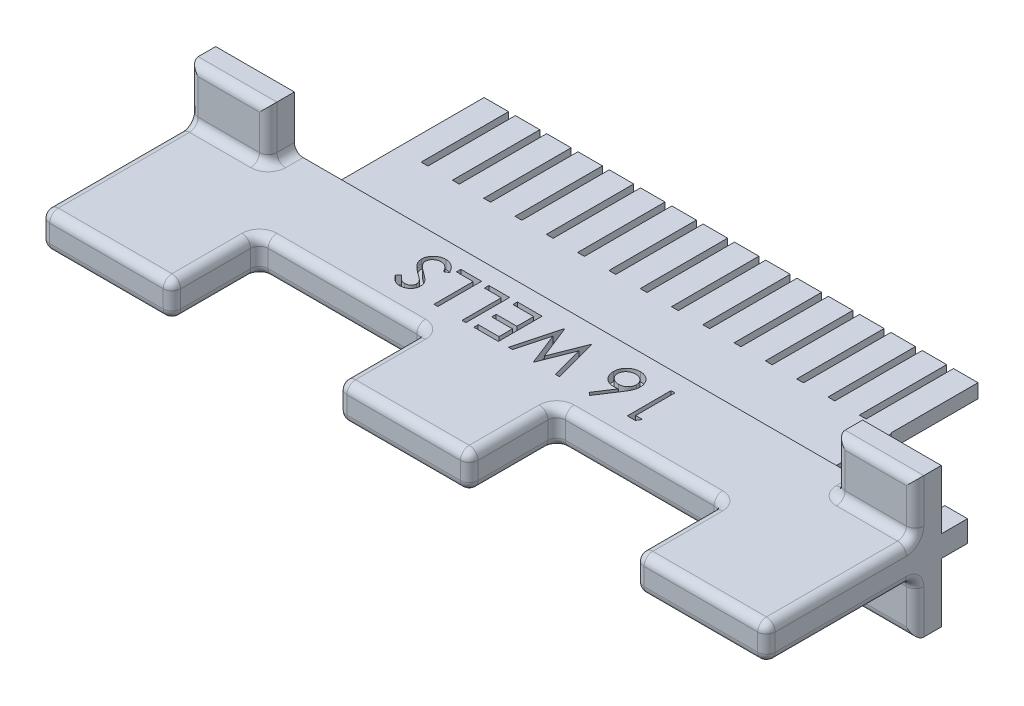
from build123d import *

# Parameters (mm, degrees)
SKETCH1_W           = 83
SKETCH1_H           = 4
BOSS_EXTRUDE1_DEPTH = 10
SKETCH2_W           = 15
SKETCH2_H           = 4
BOSS_EXTRUDE2_DEPTH = 10
SKETCH3_W           = 2.6
SKETCH3_H           = 2.45
BOSS_EXTRUDE3_DEPTH = 3
SKETCH4_W           = 56.6
SKETCH4_H           = 1.6
BOSS_EXTRUDE4_DEPTH = 7.5
SKETCH5_W           = 2.8
SKETCH5_H           = 1.6
BOSS_EXTRUDE5_DEPTH = 10
SKETCH6_W           = 9
SKETCH6_H           = 6
BOSS_EXTRUDE6_DEPTH = 3
FILLET1_R           = 1
CUT_EXTRUDE1_DEPTH  = 1


with BuildPart() as part:
    # Sketch1 → Boss-Extrude1 (new body)
    with BuildSketch(Plane.XY):
        Rectangle(SKETCH1_W, SKETCH1_H)
    extrude(amount=BOSS_EXTRUDE1_DEPTH)

    # Sketch2 → Boss-Extrude2 (add)
    with BuildSketch(Plane.XY.offset(10)):
        with Locations((-34, 0)):
            Rectangle(SKETCH2_W, SKETCH2_H)
        with Locations((34, 0)):
            Rectangle(SKETCH2_W, SKETCH2_H)
        Rectangle(SKETCH2_W, SKETCH2_H)
    extrude(amount=BOSS_EXTRUDE2_DEPTH)

    # Sketch3 → Boss-Extrude3 (add)
    with BuildSketch(Plane(origin=(0, 0, 0), x_dir=(-1, 0, 0), z_dir=(0, 0, -1))):
        with Locations((40.2, 0)):
            Rectangle(SKETCH3_W, SKETCH3_H)
        with Locations((-40.2, 0)):
            Rectangle(SKETCH3_W, SKETCH3_H)
    extrude(amount=BOSS_EXTRUDE3_DEPTH)

    # Sketch4 → Boss-Extrude4 (add)
    with BuildSketch(Plane(origin=(0, 0, 0), x_dir=(-1, 0, 0), z_dir=(0, 0, -1))):
        Rectangle(SKETCH4_W, SKETCH4_H)
    extrude(amount=BOSS_EXTRUDE4_DEPTH)

    # Sketch5 → Boss-Extrude5 (add)
    with BuildSketch(Plane(origin=(0, 0, -7.5), x_dir=(-1, 0, 0), z_dir=(0, 0, -1))):
        with Locations((26.9, 0)):
            Rectangle(SKETCH5_W, SKETCH5_H)
        with Locations((23.320008369, 0)):
            Rectangle(SKETCH5_W, SKETCH5_H)
        with Locations((19.740016738, 0)):
            Rectangle(SKETCH5_W, SKETCH5_H)
        with Locations((16.160025108, 0)):
            Rectangle(SKETCH5_W, SKETCH5_H)
        with Locations((12.580033477, 0)):
            Rectangle(SKETCH5_W, SKETCH5_H)
        with Locations((9.000041846, 0)):
            Rectangle(SKETCH5_W, SKETCH5_H)
        with Locations((5.420050215, 0)):
            Rectangle(SKETCH5_W, SKETCH5_H)
        with Locations((1.840058584, 0)):
            Rectangle(SKETCH5_W, SKETCH5_H)
        with Locations((-1.739933046, 0)):
            Rectangle(SKETCH5_W, SKETCH5_H)
        with Locations((-5.319924677, 0)):
            Rectangle(SKETCH5_W, SKETCH5_H)
        with Locations((-8.899916308, 0)):
            Rectangle(SKETCH5_W, SKETCH5_H)
        with Locations((-12.479907939, 0)):
            Rectangle(SKETCH5_W, SKETCH5_H)
        with Locations((-16.05989957, 0)):
            Rectangle(SKETCH5_W, SKETCH5_H)
        with Locations((-19.6398912, 0)):
            Rectangle(SKETCH5_W, SKETCH5_H)
        with Locations((-23.219882831, 0)):
            Rectangle(SKETCH5_W, SKETCH5_H)
        with Locations((-26.799874462, 0)):
            Rectangle(SKETCH5_W, SKETCH5_H)
    extrude(amount=BOSS_EXTRUDE5_DEPTH)

    # Sketch6 → Boss-Extrude6 (add)
    with BuildSketch(Plane(origin=(0, 0, 0), x_dir=(-1, 0, 0), z_dir=(0, 0, -1))):
        with Locations((37, -5)):
            Rectangle(SKETCH6_W, SKETCH6_H)
        with Locations((37, 5)):
            Rectangle(SKETCH6_W, SKETCH6_H)
        with Locations((-37, -5)):
            Rectangle(SKETCH6_W, SKETCH6_H)
        with Locations((-37, 5)):
            Rectangle(SKETCH6_W, SKETCH6_H)
    extrude(amount=-BOSS_EXTRUDE6_DEPTH)

    # Fillet1
    fillet1_edges = [part.edges().sort_by_distance(p)[0] for p in [
        (-41.5, -2, 11.5),
        (-32.5, -2, 1.5),
        (-37, -2, 3),
        (-32.5, -5, 3),
        (-37, -8, 3),
        (-41.5, -5, 3),
        (-26.5, 0, 20),
        (-34, -2, 20),
        (-41.5, 0, 20),
        (-34, 2, 20),
        (32.5, -2, 1.5),
        (41.5, -2, 11.5),
        (41.5, 2, 11.5),
        (32.5, 2, 1.5),
        (-32.5, 2, 1.5),
        (-41.5, 2, 11.5),
        (37, -8, 3),
        (32.5, -5, 3),
        (37, -2, 3),
        (41.5, -5, 3),
        (34, -2, 20),
        (26.5, 0, 20),
        (34, 2, 20),
        (41.5, 0, 20),
        (37, 2, 3),
        (32.5, 5, 3),
        (37, 8, 3),
        (41.5, 5, 3),
        (0, -2, 20),
        (-7.5, 0, 20),
        (0, 2, 20),
        (7.5, 0, 20),
        (-37, 8, 3),
        (-32.5, 5, 3),
        (-37, 2, 3),
        (-41.5, 5, 3),
        (26.5, 2, 15),
        (26.5, -2, 15),
        (26.5, 0, 10),
        (17, -2, 10),
        (17, 2, 10),
        (7.5, -2, 15),
        (7.5, 2, 15),
        (7.5, 0, 10),
        (-7.5, 2, 15),
        (-7.5, -2, 15),
        (-26.5, -2, 15),
        (-26.5, 2, 15),
        (-26.5, 0, 10),
        (-17, 2, 10),
        (-7.5, 0, 10),
        (-17, -2, 10),
    ]]
    fillet(fillet1_edges, radius=FILLET1_R)

    # Sketch8 → Cut-Extrude1 (cut)
    # profile 1 of 7: a face of its own
    with BuildSketch(Plane(origin=(0, 2, 0), x_dir=(1, 0, 0), z_dir=(0, 1, 0))):
        Polygon((13.552684295, -7.045024133), (12.628205128, -7.045024133), (12.628205128, -2.045024133), (13.076923077, -2.045024133), (13.076923077, -6.53220362), (13.846153846, -6.53220362), align=None)
    # profile 2 of 7: a face of its own
    with BuildSketch(Plane(origin=(0, 2, 0), x_dir=(1, 0, 0), z_dir=(0, 1, 0))):
        with BuildLine():
            Line((8.461538462, -7.173229261), (8.115985577, -6.901794967))
            Line((8.115985577, -6.901794967), (9.437099359, -4.881562595))
            add(Edge.make_bspline(
                [(9.437099359, -4.881562595), (9.34914182, -4.895582396), (9.177570696, -4.922929603), (9.003905127, -4.927440953), (8.919270833, -4.929639518)],
                knots=[0, 0, 0, 0, 1.025318673, 2, 2, 2, 2], degree=3))
            add(Edge.make_bspline(
                [(8.919270833, -4.929639518), (8.868452981, -4.928273644), (8.768419552, -4.925584962), (8.621552693, -4.904893746), (8.480425636, -4.872286446), (8.345623353, -4.824754643), (8.216661876, -4.764037027), (8.092801592, -4.691267087), (7.976369068, -4.602688023), (7.86587155, -4.503736238), (7.765531617, -4.394147426), (7.676764768, -4.277834919), (7.60179375, -4.154807915), (7.542063923, -4.025094081), (7.494329214, -3.889708799), (7.460347911, -3.748124055), (7.440033377, -3.600100888), (7.437290655, -3.499414781), (7.435897436, -3.448269326)],
                knots=[0, 0, 0, 0, 1.043709831, 2.054511743, 3.041122595, 4.01515914, 4.98481438, 5.965901842, 6.960491961, 7.985277438, 9.0096037, 10.00832444, 10.987059228, 11.962929573, 12.936966118, 13.931840027, 14.949438142, 16, 16, 16, 16], degree=3))
            add(Edge.make_bspline(
                [(7.435897436, -3.448269326), (7.43850186, -3.378337323), (7.443623728, -3.24080883), (7.481048928, -3.039706662), (7.545160273, -2.849771804), (7.632312152, -2.670508316), (7.743231776, -2.505670355), (7.876271492, -2.35719643), (8.030774462, -2.227780638), (8.203664447, -2.116808864), (8.390759824, -2.028629246), (8.586942119, -1.963439504), (8.79052636, -1.924486239), (8.92878836, -1.919386506), (8.998397436, -1.916819005)],
                knots=[0, 0, 0, 0, 1.0319111, 2.029359566, 3.00642934, 3.98275322, 4.962714161, 5.929339302, 6.915525103, 7.928435063, 8.953439721, 9.960121214, 10.9730072, 12, 12, 12, 12], degree=3))
            add(Edge.make_bspline(
                [(8.998397436, -1.916819005), (9.065681282, -1.918995947), (9.1989588, -1.923308087), (9.394964041, -1.961921675), (9.583635604, -2.024062129), (9.762547287, -2.111468404), (9.928569618, -2.220002967), (10.07824217, -2.349774456), (10.207777689, -2.500867043), (10.315972315, -2.670461295), (10.404511835, -2.851264207), (10.466375703, -3.041841312), (10.506597831, -3.23824296), (10.510737008, -3.371951231), (10.512820513, -3.439254902)],
                knots=[0, 0, 0, 0, 1.01206923, 2.004731945, 2.994948482, 3.995280086, 4.993424783, 5.973125358, 6.967517142, 7.97830003, 8.994392566, 9.989381197, 10.98793077, 12, 12, 12, 12], degree=3))
            add(Edge.make_bspline(
                [(10.512820513, -3.439254902), (10.511008444, -3.490728416), (10.507310192, -3.595780726), (10.485239448, -3.75534564), (10.444759009, -3.917975017), (10.400950325, -4.055840236), (10.357478887, -4.170017615), (10.31717117, -4.260180475), (10.27210223, -4.355395351), (10.219275156, -4.453860683), (10.163274195, -4.558389838), (10.097858717, -4.665111784), (10.029596661, -4.777924335), (9.979589618, -4.853033179), (9.953926282, -4.89157862)],
                knots=[0, 0, 0, 0, 1.17367173, 2.395347028, 3.66355231, 4.98980831, 5.690886799, 6.447442954, 7.240630024, 8.091733897, 8.994365608, 9.943299771, 10.944512865, 12, 12, 12, 12], degree=3))
            Line((9.953926282, -4.89157862), (8.461538462, -7.173229261))
        make_face()
        with BuildLine():
            add(Edge.make_bspline(
                [(9.013421474, -4.416819005), (9.051512969, -4.415703611), (9.126248167, -4.413515216), (9.235693202, -4.400882617), (9.339337805, -4.377761438), (9.437011898, -4.345216087), (9.530156965, -4.305454074), (9.617293473, -4.25503093), (9.699007852, -4.195734408), (9.773413048, -4.127484919), (9.841753315, -4.053902096), (9.900532591, -3.974603154), (9.951292067, -3.892026143), (9.992548331, -3.805390919), (10.024677944, -3.714754104), (10.047918049, -3.620526322), (10.060852048, -3.52207739), (10.063003798, -3.455316661), (10.064102564, -3.421226056)],
                knots=[0, 0, 0, 0, 1.129540697, 2.216149546, 3.260829642, 4.271906843, 5.264942922, 6.258225651, 7.250175744, 8.252297429, 9.247108021, 10.223125336, 11.173816288, 12.116901384, 13.062424938, 14.020354563, 14.989116641, 16, 16, 16, 16], degree=3))
            add(Edge.make_bspline(
                [(10.064102564, -3.421226056), (10.063173772, -3.387447556), (10.061343473, -3.320882877), (10.045832031, -3.223150606), (10.020863429, -3.129401326), (9.98536872, -3.039437277), (9.940023291, -2.953395244), (9.885787772, -2.870235084), (9.820022532, -2.792170422), (9.745311837, -2.718719464), (9.664130043, -2.651505834), (9.578453083, -2.591412869), (9.487973533, -2.541534519), (9.393654978, -2.499843303), (9.294312487, -2.469214038), (9.191628369, -2.445748532), (9.084187615, -2.432923326), (9.01144902, -2.430748487), (8.974358974, -2.429639518)],
                knots=[0, 0, 0, 0, 0.98953633, 1.950002717, 2.892353065, 3.828177645, 4.777967117, 5.738732544, 6.732276577, 7.76327951, 8.805689376, 9.818183401, 10.825652611, 11.829169732, 12.834974292, 13.867693979, 14.912718532, 16, 16, 16, 16], degree=3))
            add(Edge.make_bspline(
                [(8.974358974, -2.429639518), (8.937268868, -2.430748401), (8.864530154, -2.43292307), (8.757090265, -2.445749504), (8.654402952, -2.469210476), (8.555072063, -2.499856206), (8.460710479, -2.541486358), (8.370151771, -2.591727278), (8.283656757, -2.651141539), (8.20252776, -2.718835694), (8.127505283, -2.791753754), (8.06325123, -2.87094867), (8.007266631, -2.952740783), (7.96365055, -3.039779511), (7.927758424, -3.129347828), (7.902912145, -3.223165208), (7.887367634, -3.320879068), (7.885541874, -3.387446273), (7.884615385, -3.421226056)],
                knots=[0, 0, 0, 0, 1.087095469, 2.131941252, 3.164484274, 4.170116773, 5.173462224, 6.180759088, 7.201132453, 8.243363996, 9.274190558, 10.261329848, 11.227346438, 12.172477233, 13.108141724, 14.050330866, 15.010632948, 16, 16, 16, 16], degree=3))
            add(Edge.make_bspline(
                [(7.884615385, -3.421226056), (7.885392355, -3.455365091), (7.886917294, -3.522368915), (7.904499212, -3.620437623), (7.928246512, -3.715520331), (7.966624351, -3.805475074), (8.012335402, -3.892789738), (8.070568622, -3.974967762), (8.137333118, -4.054341361), (8.214658036, -4.127972658), (8.298761203, -4.195369367), (8.388270164, -4.254684097), (8.481535829, -4.305316996), (8.579876475, -4.345269963), (8.681967754, -4.377456635), (8.78851494, -4.40072775), (8.899593726, -4.413534885), (8.974995614, -4.415710355), (9.013421474, -4.416819005)],
                knots=[0, 0, 0, 0, 0.978317929, 1.920119929, 2.851929572, 3.784133089, 4.71845084, 5.67514162, 6.667477147, 7.690549442, 8.733345855, 9.756283585, 10.767808623, 11.772962645, 12.797066014, 13.836159554, 14.89727653, 16, 16, 16, 16], degree=3))
        make_face(mode=Mode.SUBTRACT)
    # profile 3 of 7: a face of its own
    with BuildSketch(Plane(origin=(0, 2, 0), x_dir=(1, 0, 0), z_dir=(0, 1, 0))):
        Polygon((4.871794872, -7.045024133), (4.408052885, -7.045024133), (3.429487179, -3.378157146), (1.974158654, -7.045024133), (1.909054487, -7.045024133), (0.480769231, -3.40319721), (-0.502804487, -7.045024133), (-0.961538462, -7.045024133), (0.38661859, -2.045024133), (0.450721154, -2.045024133), (1.955128205, -5.869142723), (3.477564103, -2.045024133), (3.541666667, -2.045024133), align=None)
    # profile 4 of 7: a face of its own
    with BuildSketch(Plane(origin=(0, 2, 0), x_dir=(1, 0, 0), z_dir=(0, 1, 0))):
        Polygon((-2.115384615, -7.045024133), (-4.935897436, -7.045024133), (-4.935897436, -6.53220362), (-2.564102564, -6.53220362), (-2.564102564, -4.993742082), (-4.935897436, -4.993742082), (-4.935897436, -4.480921569), (-2.564102564, -4.480921569), (-2.564102564, -2.557844646), (-4.935897436, -2.557844646), (-4.935897436, -2.045024133), (-2.115384615, -2.045024133), align=None)
    # profile 5 of 7: a face of its own
    with BuildSketch(Plane(origin=(0, 2, 0), x_dir=(1, 0, 0), z_dir=(0, 1, 0))):
        Polygon((-5.833333333, -7.045024133), (-6.282051282, -7.045024133), (-6.282051282, -2.557844646), (-8.205128205, -2.557844646), (-8.205128205, -2.045024133), (-5.833333333, -2.045024133), align=None)
    # profile 6 of 7: a face of its own
    with BuildSketch(Plane(origin=(0, 2, 0), x_dir=(1, 0, 0), z_dir=(0, 1, 0))):
        Polygon((-9.038461538, -7.045024133), (-9.487179487, -7.045024133), (-9.487179487, -2.557844646), (-11.41025641, -2.557844646), (-11.41025641, -2.045024133), (-9.038461538, -2.045024133), align=None)
    # profile 7 of 7: a face of its own
    with BuildSketch(Plane(origin=(0, 2, 0), x_dir=(1, 0, 0), z_dir=(0, 1, 0))):
        with BuildLine():
            Line((-11.730769231, -3.009567402), (-12.153445513, -3.262972851))
            add(Edge.make_bspline(
                [(-12.153445513, -3.262972851), (-12.19275728, -3.197166587), (-12.26807711, -3.071084324), (-12.393721909, -2.900715695), (-12.523911782, -2.755912614), (-12.65961083, -2.63751746), (-12.799990755, -2.544304765), (-12.945967975, -2.478301577), (-13.097050562, -2.437135898), (-13.199870307, -2.432135774), (-13.251201923, -2.429639518)],
                knots=[0, 0, 0, 0, 1.272034388, 2.437168799, 3.508375237, 4.49857839, 5.41946034, 6.295179144, 7.148887113, 8, 8, 8, 8], degree=3))
            add(Edge.make_bspline(
                [(-13.251201923, -2.429639518), (-13.295031425, -2.430889524), (-13.381923515, -2.433367665), (-13.510093304, -2.456217403), (-13.633949284, -2.493599407), (-13.752258746, -2.544275191), (-13.86189274, -2.606565217), (-13.959557889, -2.680022202), (-14.042078161, -2.764880154), (-14.110300045, -2.858079446), (-14.163705264, -2.957674629), (-14.20170435, -3.061212939), (-14.226114139, -3.168034604), (-14.22920895, -3.240474158), (-14.230769231, -3.276995287)],
                knots=[0, 0, 0, 0, 1.095645842, 2.172120455, 3.244862764, 4.326153987, 5.384857088, 6.392105572, 7.372507978, 8.334705661, 9.272564127, 10.189475455, 11.087205874, 12, 12, 12, 12], degree=3))
            add(Edge.make_bspline(
                [(-14.230769231, -3.276995287), (-14.228708308, -3.318638967), (-14.224534716, -3.40297196), (-14.187752567, -3.52760827), (-14.131587765, -3.65148293), (-14.078799163, -3.72812182), (-14.051482372, -3.767780543)],
                knots=[0, 0, 0, 0, 0.938992559, 1.901562324, 2.914110574, 4, 4, 4, 4], degree=3))
            add(Edge.make_bspline(
                [(-14.051482372, -3.767780543), (-14.029162446, -3.796481036), (-13.98216701, -3.856910995), (-13.900185198, -3.94528344), (-13.806966714, -4.03885355), (-13.700098095, -4.13575368), (-13.581137716, -4.237965999), (-13.448736901, -4.343594856), (-13.304441636, -4.454215663), (-13.202665983, -4.527277526), (-13.150040064, -4.565056185)],
                knots=[0, 0, 0, 0, 0.722283655, 1.520795216, 2.39349503, 3.346893347, 4.386874146, 5.510198126, 6.712579003, 8, 8, 8, 8], degree=3))
            add(Edge.make_bspline(
                [(-13.150040064, -4.565056185), (-13.097441372, -4.602534172), (-12.996876679, -4.674189229), (-12.856130845, -4.780398761), (-12.73044183, -4.878123265), (-12.619169188, -4.966001475), (-12.525191683, -5.047866194), (-12.445073758, -5.119329929), (-12.381771268, -5.184208764), (-12.346544926, -5.226263007), (-12.330729167, -5.245144326)],
                knots=[0, 0, 0, 0, 1.452255772, 2.776602448, 3.96446981, 5.032613149, 5.964194703, 6.766668629, 7.446264616, 8, 8, 8, 8], degree=3))
            add(Edge.make_bspline(
                [(-12.330729167, -5.245144326), (-12.308629235, -5.274575839), (-12.265166755, -5.332456861), (-12.207733954, -5.422900125), (-12.159300716, -5.51530739), (-12.120321016, -5.610013561), (-12.088799608, -5.706306865), (-12.066884144, -5.804910234), (-12.053375915, -5.905154288), (-12.051980553, -5.972599812), (-12.051282051, -6.006362274)],
                knots=[0, 0, 0, 0, 1.068019517, 2.100403715, 3.106014851, 4.09224787, 5.069873182, 6.043214339, 7.020455327, 8, 8, 8, 8], degree=3))
            add(Edge.make_bspline(
                [(-12.051282051, -6.006362274), (-12.053138419, -6.059266485), (-12.056811476, -6.163944115), (-12.088131424, -6.316779541), (-12.13698211, -6.463148887), (-12.207657854, -6.599794501), (-12.294955621, -6.726522677), (-12.398578237, -6.841085368), (-12.52046626, -6.939539184), (-12.656158757, -7.023232798), (-12.802950071, -7.090001634), (-12.957219134, -7.138653592), (-13.118272742, -7.167166609), (-13.227719371, -7.171188521), (-13.283253205, -7.173229261)],
                knots=[0, 0, 0, 0, 1.005367131, 1.989245246, 2.955191616, 3.932180104, 4.904534562, 5.875498653, 6.859376768, 7.874484044, 8.900379497, 9.918679785, 10.943926428, 12, 12, 12, 12], degree=3))
            add(Edge.make_bspline(
                [(-13.283253205, -7.173229261), (-13.342191557, -7.171262547), (-13.459073357, -7.167362316), (-13.631051248, -7.131365167), (-13.797619592, -7.075434995), (-13.931111047, -7.008823238), (-14.03562621, -6.943010929), (-14.115246444, -6.882914417), (-14.196369961, -6.813878112), (-14.278122688, -6.734439505), (-14.361312361, -6.646189546), (-14.445555592, -6.548380569), (-14.531640811, -6.441894176), (-14.587003214, -6.365855922), (-14.615384615, -6.326875095)],
                knots=[0, 0, 0, 0, 1.286534051, 2.551350862, 3.822568981, 5.117864672, 5.799956111, 6.519305446, 7.295594771, 8.126302591, 9.008831062, 9.944975596, 10.946496709, 12, 12, 12, 12], degree=3))
            Line((-14.615384615, -6.326875095), (-14.209735577, -6.019383108))
            add(Edge.make_bspline(
                [(-14.209735577, -6.019383108), (-14.185243174, -6.050940207), (-14.138076532, -6.111711801), (-14.066439221, -6.196789377), (-13.999021661, -6.274609563), (-13.932090714, -6.342024516), (-13.870805632, -6.404083282), (-13.810267784, -6.45627091), (-13.752815834, -6.500244196), (-13.680563611, -6.547233413), (-13.588803083, -6.592695827), (-13.474690207, -6.631782667), (-13.355360306, -6.655803848), (-13.274349871, -6.658856909), (-13.233173077, -6.660408749)],
                knots=[0, 0, 0, 0, 1.181426797, 2.275151783, 3.28963443, 4.225459815, 5.084396437, 5.868484344, 6.587427557, 7.222918358, 8.415355282, 9.605213164, 10.782753814, 12, 12, 12, 12], degree=3))
            add(Edge.make_bspline(
                [(-13.233173077, -6.660408749), (-13.181508713, -6.658706093), (-13.081878854, -6.655422682), (-12.940763152, -6.618619291), (-12.813018227, -6.562662214), (-12.70352072, -6.481972694), (-12.613110326, -6.385775243), (-12.546899331, -6.276068826), (-12.507312941, -6.154902356), (-12.502467636, -6.07042095), (-12.5, -6.027395928)],
                knots=[0, 0, 0, 0, 1.144248881, 2.206576175, 3.214949548, 4.222996039, 5.203671638, 6.127710127, 7.046472867, 8, 8, 8, 8], degree=3))
            add(Edge.make_bspline(
                [(-12.5, -6.027395928), (-12.500620232, -6.000621284), (-12.501869335, -5.946699014), (-12.516761678, -5.867196304), (-12.538985378, -5.788629526), (-12.570486859, -5.710546018), (-12.613297744, -5.630721251), (-12.671442442, -5.549610209), (-12.744202832, -5.465182894), (-12.800044516, -5.410325386), (-12.829527244, -5.381362274)],
                knots=[0, 0, 0, 0, 0.858500039, 1.728959331, 2.587258638, 3.476905708, 4.426389682, 5.487945037, 6.673710648, 8, 8, 8, 8], degree=3))
            add(Edge.make_bspline(
                [(-12.829527244, -5.381362274), (-12.840472061, -5.371595095), (-12.866474443, -5.348390511), (-12.91401148, -5.310401539), (-12.976786906, -5.263540436), (-13.053161479, -5.205558555), (-13.144543424, -5.138299323), (-13.25094279, -5.062622734), (-13.371173551, -4.976072079), (-13.456490574, -4.915561306), (-13.501602564, -4.8835658)],
                knots=[0, 0, 0, 0, 0.420754252, 0.999615792, 1.744751191, 2.668019286, 3.750313428, 4.999500688, 6.413464383, 8, 8, 8, 8], degree=3))
            add(Edge.make_bspline(
                [(-13.501602564, -4.8835658), (-13.555868116, -4.844078115), (-13.660945837, -4.767615687), (-13.810457183, -4.652736522), (-13.946017993, -4.540381275), (-14.06811424, -4.431274748), (-14.177918557, -4.32622016), (-14.274324052, -4.224035058), (-14.357768141, -4.125389559), (-14.448828501, -3.99977991), (-14.540772471, -3.844082152), (-14.619606868, -3.653237045), (-14.669759962, -3.461844272), (-14.676273465, -3.333371554), (-14.679487179, -3.269984069)],
                knots=[0, 0, 0, 0, 1.163604038, 2.253157948, 3.268574773, 4.215621239, 5.091738613, 5.902582348, 6.650434646, 7.330118262, 8.591011492, 9.77460283, 10.902005569, 12, 12, 12, 12], degree=3))
            add(Edge.make_bspline(
                [(-14.679487179, -3.269984069), (-14.678546932, -3.225158662), (-14.676684696, -3.136378326), (-14.655333465, -3.006001884), (-14.623939687, -2.879431158), (-14.577151037, -2.758241266), (-14.518663866, -2.641081534), (-14.447456202, -2.528157389), (-14.361160622, -2.421324295), (-14.265296586, -2.318507524), (-14.158815896, -2.225519919), (-14.046137586, -2.142697321), (-13.927894092, -2.071782763), (-13.802735095, -2.016070712), (-13.672722304, -1.971505835), (-13.53724543, -1.939562904), (-13.396013359, -1.919891418), (-13.300011283, -1.917854576), (-13.251201923, -1.916819005)],
                knots=[0, 0, 0, 0, 0.98378539, 1.948466333, 2.894822735, 3.844243623, 4.795447569, 5.768042124, 6.770299647, 7.807997672, 8.852593179, 9.870666288, 10.876941106, 11.874841786, 12.874492863, 13.892063892, 14.928283473, 16, 16, 16, 16], degree=3))
            add(Edge.make_bspline(
                [(-13.251201923, -1.916819005), (-13.213438814, -1.917557632), (-13.138388184, -1.919025584), (-13.027677186, -1.931695771), (-12.918999185, -1.95027676), (-12.813718731, -1.978606014), (-12.710525014, -2.013786535), (-12.610337414, -2.056859669), (-12.512914249, -2.108137258), (-12.418135174, -2.167698619), (-12.325132693, -2.236358883), (-12.234282151, -2.315634394), (-12.145128754, -2.40514569), (-12.057302169, -2.504768208), (-11.972871263, -2.616148638), (-11.88971285, -2.737520615), (-11.80825994, -2.869276248), (-11.757081922, -2.961930236), (-11.730769231, -3.009567402)],
                knots=[0, 0, 0, 0, 0.915366252, 1.81920441, 2.69897508, 3.586533125, 4.459536084, 5.340758185, 6.227946952, 7.126403341, 8.052553006, 9.028121456, 10.047063623, 11.114014537, 12.24582441, 13.433687931, 14.680555077, 16, 16, 16, 16], degree=3))
        make_face()
    extrude(amount=-CUT_EXTRUDE1_DEPTH, mode=Mode.SUBTRACT)


solid = part.part
